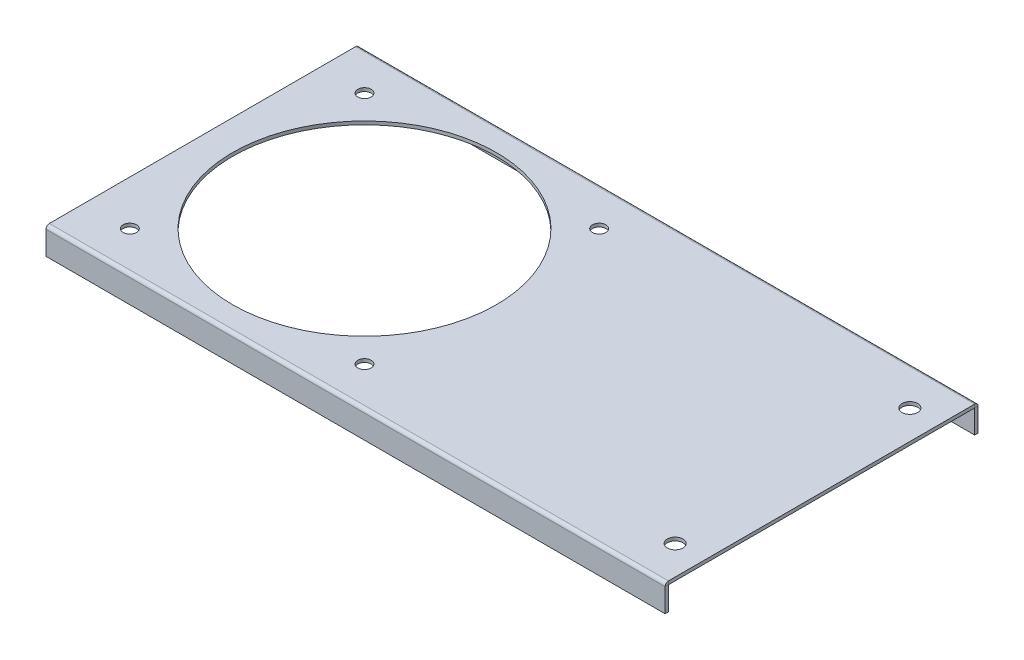
from build123d import *

# Parameters (mm, degrees)
SM_START               = -138.5
SM_BASE_FLANGE_1_DEPTH = 277
SKETCH_6_R             = 59
SKETCH_6_R_2           = 3
SKETCH_6_R_3           = 3.5
CUT_EXTRUDE_1_DEPTH    = 156.647839689


# Read off the part's stored shape, not the designer's step: 基体-法兰1
with BuildPart() as part:
    # 基体-法兰1 outline → 基体-法兰1 (new body)
    with BuildSketch(Plane(origin=(0, 0, 0), x_dir=(0, 0, -1), z_dir=(1, 0, 0)).offset(SM_START)):
        with BuildLine():
            Line((68.5, -1.5), (68.5, -12))
            Line((68.5, -12), (70, -12))
            Line((70, -12), (70, -1.5))
            ThreePointArc((70, -1.5), (69.560660172, -0.439339828), (68.5, 0))
            Line((68.5, 0), (-68.5, 0))
            ThreePointArc((-68.5, 0), (-69.560660172, -0.439339828), (-70, -1.5))
            Line((-70, -1.5), (-70, -12))
            Line((-70, -12), (-68.5, -12))
            Line((-68.5, -12), (-68.5, -1.5))
            Line((-68.5, -1.5), (68.5, -1.5))
        make_face()
    extrude(amount=SM_BASE_FLANGE_1_DEPTH)

    # 草图6 → 切除-拉伸1 (cut, through all)
    with BuildSketch(Plane(origin=(0, 0, 0), x_dir=(1, 0, 0), z_dir=(0, 1, 0))):
        with Locations(Location((-66, 0, 0), (0, 0, 270))):
            Circle(SKETCH_6_R)
        with Locations(Location((-118.5, 52.5, 0), (0, 0, 270))):
            Circle(SKETCH_6_R_2)
        with Locations(Location((-13.5, 52.5, 0), (0, 0, 270))):
            Circle(SKETCH_6_R_2)
        with Locations(Location((-13.5, -52.5, 0), (0, 0, 270))):
            Circle(SKETCH_6_R_2)
        with Locations(Location((-118.5, -52.5, 0), (0, 0, 270))):
            Circle(SKETCH_6_R_2)
        with Locations(Location((125.5, 52.5, 0), (0, 0, 270))):
            Circle(SKETCH_6_R_3)
        with Locations(Location((125.5, -52.5, 0), (0, 0, 270))):
            Circle(SKETCH_6_R_3)
    extrude(amount=-CUT_EXTRUDE_1_DEPTH, mode=Mode.SUBTRACT)


solid = part.part
